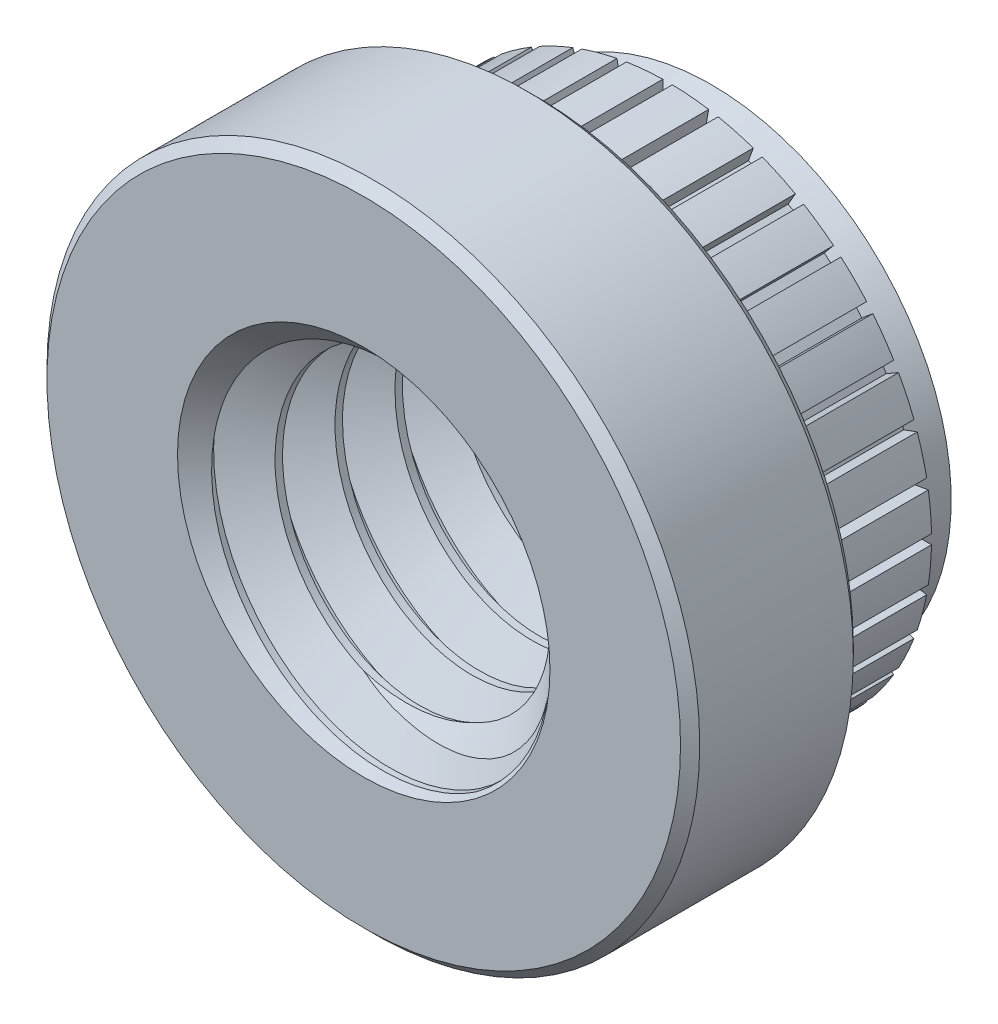
from build123d import *

# Parameters (mm, degrees)
SKETCH1_R               = 4.318
EXTRUDE1_DEPTH          = 2.286
SKETCH2_R               = 3.4925
EXTRUDE2_DEPTH          = 2.3114
SKETCH3_W               = 0.127
SKETCH3_H               = 1.016
CUT_EXTRUDE_THIN1_DEPTH = 2.3114
CIRPATTERN1_COUNT       = 36
SKETCH5_OUTSIDE_W       = 13.666
SKETCH5_OUTSIDE_H       = 13.666
SKETCH5_OUTSIDE_R       = 3.175
CUT_EXTRUDE1_DEPTH      = 0.57785
CUT_EXTRUDE1_DRAFT      = 20
CHAMFER2_SIZE           = 0.127
SKETCH7_R               = 2.413
CUT_EXTRUDE3_DEPTH      = 8.643712106
SWEEP1_PITCH            = 0.79375
SKETCH10_R              = 4.318
CUT_EXTRUDE4_DEPTH      = 9.080632316
SKETCH11_R              = 3.175
CUT_EXTRUDE5_DEPTH      = 8.643712166


with BuildPart() as part:
    # Sketch1 → Extrude1 (new body)
    with BuildSketch(Plane.XY):
        Circle(SKETCH1_R)
    extrude(amount=-EXTRUDE1_DEPTH)

    # Sketch2 → Extrude2 (add)
    with BuildSketch(Plane(origin=(0, 0, -2.286), x_dir=(-1, 0, 0), z_dir=(0, 0, -1))):
        with Locations(Location((0, 0, 0), (0, 0, 180))):
            Circle(SKETCH2_R)
    extrude(amount=EXTRUDE2_DEPTH)

    # Sketch3 → Cut-Extrude-Thin1 (cut)
    with BuildSketch(Plane(origin=(0, 0, -4.5974), x_dir=(-1, 0, 0), z_dir=(0, 0, -1))):
        with Locations((0, 3.81)):
            Rectangle(SKETCH3_W, SKETCH3_H)
    cut_extrude_thin1 = extrude(amount=-CUT_EXTRUDE_THIN1_DEPTH, mode=Mode.SUBTRACT)

    # CirPattern1: Cut-Extrude-Thin1 ×36 about axis
    cirpattern1_axis = Axis((0, 0, 0), (0, 0, 1))
    for i in range(1, CIRPATTERN1_COUNT):
        add(cut_extrude_thin1.rotate(cirpattern1_axis, i * 360 / CIRPATTERN1_COUNT), mode=Mode.SUBTRACT)


with BuildPart() as cut_extrude1_tool:
    # Sketch5 outside → Cut-Extrude1 (with draft: the straight prism first)
    with BuildSketch(Plane(origin=(0, 0, -4.5974), x_dir=(-1, 0, 0), z_dir=(0, 0, -1))):
        Rectangle(SKETCH5_OUTSIDE_W, SKETCH5_OUTSIDE_H)
        Circle(SKETCH5_OUTSIDE_R, mode=Mode.SUBTRACT)
    extrude(amount=-CUT_EXTRUDE1_DEPTH)
    # Cut-Extrude1: the draft: its side faces are tilted about the plane it starts from
    cut_extrude1_sides = [cut_extrude1_tool.faces().sort_by_distance(p)[0] for p in [
        (0, -6.833, -4.308475),
        (-6.833, 0, -4.308475),
        (0, 6.833, -4.308475),
        (6.833, 0, -4.308475),
        (3.175, 0, -4.308475),
    ]]
    draft(cut_extrude1_sides, Plane(origin=(0, 0, -4.5974), x_dir=(-1, 0, 0), z_dir=(0, 0, -1)), CUT_EXTRUDE1_DRAFT)


with BuildPart() as part_1:
    add(part.part)

    # Cut-Extrude1: cut by cut_extrude1_tool
    add(cut_extrude1_tool.part, mode=Mode.SUBTRACT)

    # Chamfer2
    chamfer2_edges = [part_1.edges().sort_by_distance(p)[0] for p in [
        (-4.318, 0, 0),
        (-4.318, 0, -2.286),
    ]]
    chamfer(chamfer2_edges, length=CHAMFER2_SIZE)

    # Sketch7 → Cut-Extrude3 (cut, through all)
    with BuildSketch(Plane.XY):
        Circle(SKETCH7_R)
    extrude(amount=-CUT_EXTRUDE3_DEPTH, mode=Mode.SUBTRACT)

    # Sweep1: the profile of Sketch9 profile screwed along a right-hand helix of 9.792 turns, 6 arcs to a turn; built about Z, then put on its axis
    sweep1_z = Axis((0, 0, 0), (0, 0, 1))
    sweep1_corners = [(2.4133, 0, -0.694704455), (1.897444252, 0, -0.396875), (1.897444252, 0, -0.29765625), (2.4133, 0, 0.000173205)]
    with BuildLine(mode=Mode.PRIVATE) as sweep1_profile:
        Line(sweep1_corners[0], sweep1_corners[1])
        Line(sweep1_corners[1], sweep1_corners[2])
        Line(sweep1_corners[2], sweep1_corners[3])
        Line(sweep1_corners[3], sweep1_corners[0])
    sweep1_cap = Face(sweep1_profile.wire())
    sweep1_turn_angles = [0, 30, 60, 90, 120, 150, 180, 210, 240, 270, 300, 330, 360]
    sweep1_turn_weights = [1, 0.8660254037844387, 1, 0.8660254037844387, 1, 0.8660254037844387, 1, 0.8660254037844387, 1, 0.8660254037844387, 1, 0.8660254037844387, 1]
    sweep1_turn_rails = [Edge.make_bspline([Vector(p[0], p[1], 0).rotate(sweep1_z, sweep1_turn_angles[k]) / sweep1_turn_weights[k] + Vector(0, 0, p[2] + SWEEP1_PITCH * sweep1_turn_angles[k] / 360) for k in range(13)], [0, 0, 0, 1, 1, 2, 2, 3, 3, 4, 4, 5, 5, 6, 6, 6], 2, sweep1_turn_weights) for p in sweep1_corners]
    sweep1_turn_sides = [Face.make_surface_from_curves(sweep1_turn_rails[p[0]], sweep1_turn_rails[p[1]]) for p in [(0, 1), (1, 2), (2, 3), (3, 0)]]
    sweep1_turn = Solid(Shell([*sweep1_turn_sides, sweep1_cap, sweep1_cap.rotate(sweep1_z, 360).moved(Location((0, 0, SWEEP1_PITCH * 360 / 360)))]))
    sweep1_last_angles = [3240, 3270, 3300, 3330, 3360, 3390, 3420, 3450, 3480, 3502.56, 3525.12]
    sweep1_last_weights = [1, 0.8660254037844387, 1, 0.8660254037844387, 1, 0.8660254037844387, 1, 0.8660254037844387, 1, 0.923478280857704, 1]
    sweep1_last_rails = [Edge.make_bspline([Vector(p[0], p[1], 0).rotate(sweep1_z, sweep1_last_angles[k]) / sweep1_last_weights[k] + Vector(0, 0, p[2] + SWEEP1_PITCH * sweep1_last_angles[k] / 360) for k in range(11)], [0, 0, 0, 1, 1, 2, 2, 3, 3, 4, 4, 5, 5, 5], 2, sweep1_last_weights) for p in sweep1_corners]
    sweep1_last_sides = [Face.make_surface_from_curves(sweep1_last_rails[p[0]], sweep1_last_rails[p[1]]) for p in [(0, 1), (1, 2), (2, 3), (3, 0)]]
    sweep1_last = Solid(Shell([*sweep1_last_sides, sweep1_cap.rotate(sweep1_z, 3240).moved(Location((0, 0, SWEEP1_PITCH * 3240 / 360))), sweep1_cap.rotate(sweep1_z, 3525.12).moved(Location((0, 0, SWEEP1_PITCH * 3525.12 / 360)))]))
    sweep1_each = [*[sweep1_turn.moved(Location((0, 0, SWEEP1_PITCH * i))) for i in range(9)], sweep1_last]
    add(Plane(origin=(0, 0, -4.5974), x_dir=(0, 1, 0), z_dir=(0, 0, 1)) * Compound([sweep1_each[i] for i in range(0, 10, 2)]))
    add(Plane(origin=(0, 0, -4.5974), x_dir=(0, 1, 0), z_dir=(0, 0, 1)) * Compound([sweep1_each[i] for i in range(1, 10, 2)]))

    # Sketch10 → Cut-Extrude4 (cut, through all)
    with BuildSketch(Plane.XY):
        Circle(SKETCH10_R)
    extrude(amount=CUT_EXTRUDE4_DEPTH, mode=Mode.SUBTRACT)

    # Sketch11 → Cut-Extrude5 (cut, through all)
    with BuildSketch(Plane(origin=(0, 0, -4.5974), x_dir=(-1, 0, 0), z_dir=(0, 0, -1))):
        Circle(SKETCH11_R)
    extrude(amount=CUT_EXTRUDE5_DEPTH, mode=Mode.SUBTRACT)

    # Cut-Extrude6 cone 1 section (through the dimple's axis) → Cut-Extrude6 (revolve, cut)
    with BuildSketch(Plane(origin=(0, 0, 0), x_dir=(0, -1, 0), z_dir=(1, 0, 0))):
        Polygon((0, 0), (2.4638, 0), (0, 2.4638), align=None)
    revolve(axis=Axis((0, 0, 0), (0, 0, -1)), mode=Mode.SUBTRACT)

    # Cut-Extrude7 cone 1 section (through the dimple's axis) → Cut-Extrude7 (revolve, cut)
    with BuildSketch(Plane(origin=(0, 0, -4.5974), x_dir=(0, 1, 0), z_dir=(1, 0, 0))):
        Polygon((0, 0), (2.4638, 0), (0, 2.4638), align=None)
    revolve(axis=Axis((0, 0, -4.5974), (0, 0, 1)), mode=Mode.SUBTRACT)


solid = part_1.part
